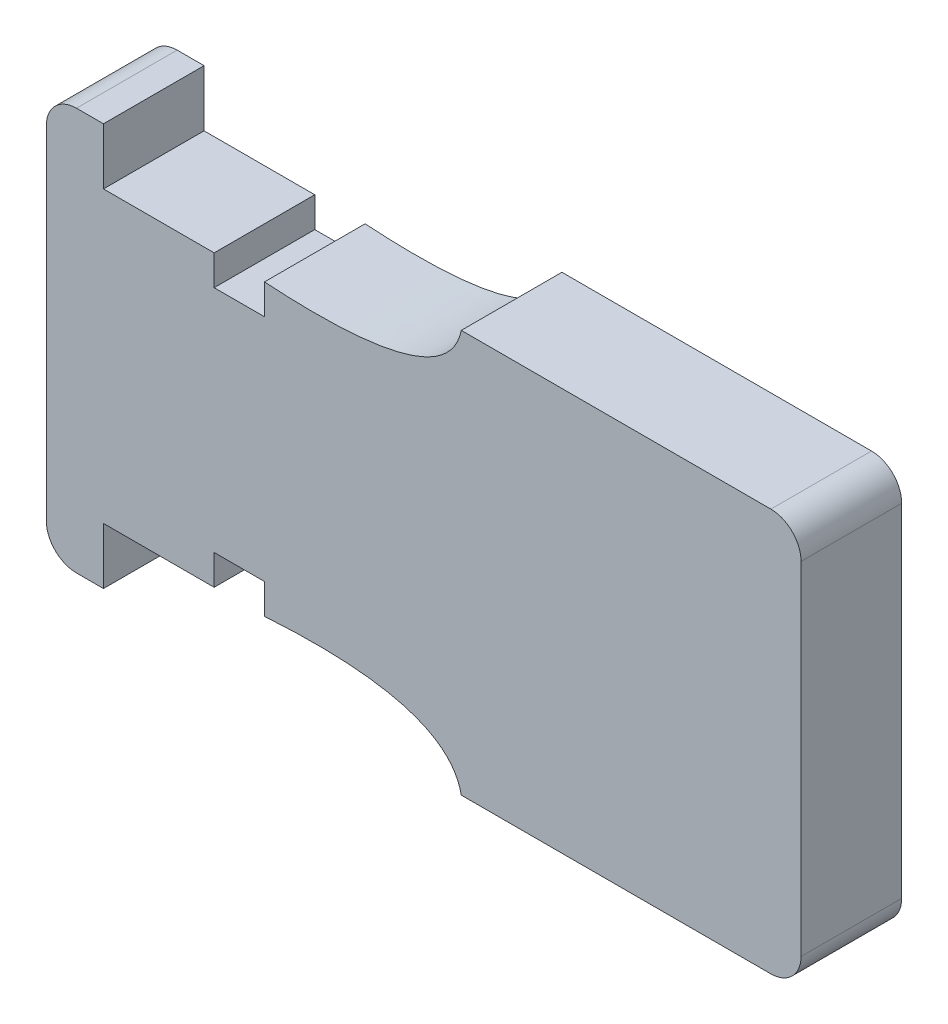
from build123d import *

# Parameters (mm, degrees)
EXTRUDE_THIN2_START                       = -25.4
EXTRUDE_THIN2_DEPTH                       = 25.4
BOSS_EXTRUDE1_START                       = -2.54
BOSS_EXTRUDE1_DEPTH                       = 2.54
BOSS_EXTRUDE2_DEPTH                       = 2.54
F_15_64_0_23438_DIAMETER_HOLE1_AT_2_COUNT = 2
F_15_64_0_23438_DIAMETER_HOLE1_AT_2_PITCH = 86.36
F_15_64_0_23438_DIAMETER_HOLE1_AT_3_COUNT = 2
F_15_64_0_23438_DIAMETER_HOLE1_AT_3_PITCH = 195.381977675
F_15_64_0_23438_DIAMETER_HOLE1_AT_4_COUNT = 2
F_15_64_0_23438_DIAMETER_HOLE1_AT_4_PITCH = 175.26


# Read off the part's stored shape, not the designer's step: Extrude-Thin2
with BuildPart() as part:
    # Extrude-Thin2 outline → Extrude-Thin2 (new body)
    with BuildSketch(Plane.XY.offset(EXTRUDE_THIN2_START)):
        with BuildLine():
            Line((-80.828024073, 36.556311377), (-80.828024073, 50.8))
            Line((-80.828024073, 50.8), (-87.63, 50.8))
            ThreePointArc((-87.63, 50.8), (-93.018153673, 48.568153673), (-95.25, 43.18))
            Line((-95.25, 43.18), (-95.25, -43.18))
            ThreePointArc((-95.25, -43.18), (-93.018153673, -48.568153673), (-87.63, -50.8))
            Line((-87.63, -50.8), (-80.828024073, -50.8))
            Line((-80.828024073, -50.8), (-80.828024073, -36.556311377))
            Line((-80.828024073, -36.556311377), (-52.888024073, -36.556311377))
            Line((-52.888024073, -36.556311377), (-52.888024073, -28.936311377))
            Line((-52.888024073, -28.936311377), (-40.188024073, -28.936311377))
            Line((-40.188024073, -28.936311377), (-40.188024073, -36.556311377))
            add(Edge.make_bspline(
                [(-40.188024073, -36.556311377), (6.000491779, -33.499243365), (9.490782471, -50.8)],
                knots=[0, 0, 0, 0.610951086, 0.610951086, 0.610951086], degree=2))
            Line((9.490782471, -50.8), (87.63, -50.8))
            ThreePointArc((87.63, -50.8), (93.018153673, -48.568153673), (95.25, -43.18))
            Line((95.25, -43.18), (95.25, 43.18))
            ThreePointArc((95.25, 43.18), (93.018153673, 48.568153673), (87.63, 50.8))
            Line((87.63, 50.8), (9.490782471, 50.8))
            add(Edge.make_bspline(
                [(9.490782471, 50.8), (6.000491779, 33.499243365), (-40.188024073, 36.556311377)],
                knots=[0, 0, 0, 0.610951086, 0.610951086, 0.610951086], degree=2))
            Line((-40.188024073, 36.556311377), (-40.188024073, 28.936311377))
            Line((-40.188024073, 28.936311377), (-52.888024073, 28.936311377))
            Line((-52.888024073, 28.936311377), (-52.888024073, 36.556311377))
            Line((-52.888024073, 36.556311377), (-80.828024073, 36.556311377))
        make_face()
        with BuildLine():
            Line((-87.63, 48.768), (-82.860024073, 48.768))
            Line((-82.860024073, 48.768), (-82.860024073, 34.524311377))
            Line((-82.860024073, 34.524311377), (-54.920024073, 34.524311377))
            Line((-54.920024073, 34.524311377), (-54.920024073, 26.904311377))
            Line((-54.920024073, 26.904311377), (-38.156024073, 26.904311377))
            Line((-38.156024073, 26.904311377), (-38.156024073, 34.395144422))
            add(Edge.make_bspline(
                [(11.059099877, 48.768), (10.705913599, 47.666821526), (10.231462505, 46.631478385), (9.34485534, 45.173434414), (9.020114118, 44.703275583), (8.31285443, 43.794325504), (7.932752955, 43.359154617), (6.738556789, 42.126829372), (5.863761314, 41.393125544), (4.455909096, 40.399393999), (3.970643089, 40.086351658), (2.987111557, 39.50137004), (2.48684241, 39.227961499), (0.964119528, 38.456915884), (-0.080085669, 38.008090834), (-1.679731191, 37.409665787), (-2.218549861, 37.222765467), (-3.306137501, 36.871294096), (-3.856031524, 36.7064305), (-6.610131831, 35.936843126), (-8.830751105, 35.489873067), (-13.293085078, 34.801180583), (-15.535017784, 34.561579267), (-20.033665755, 34.226203327), (-22.290452983, 34.13112888), (-26.815059954, 34.048320676), (-29.084850225, 34.060938072), (-33.62255889, 34.169687173), (-35.889894754, 34.26582406), (-38.156024073, 34.395144422)],
                knots=[0, 0, 0, 0, 0.0625, 0.0625, 0.09375, 0.09375, 0.125, 0.125, 0.1875, 0.1875, 0.21875, 0.21875, 0.25, 0.25, 0.3125, 0.3125, 0.34375, 0.34375, 0.375, 0.375, 0.5, 0.5, 0.625, 0.625, 0.75, 0.75, 0.875, 0.875, 1, 1, 1, 1], degree=3))
            Line((11.059099877, 48.768), (87.63, 48.768))
            ThreePointArc((87.63, 48.768), (91.581312693, 47.131312693), (93.218, 43.18))
            Line((93.218, 43.18), (93.218, -43.18))
            ThreePointArc((93.218, -43.18), (91.581312693, -47.131312693), (87.63, -48.768))
            Line((87.63, -48.768), (11.059099877, -48.768))
            add(Edge.make_bspline(
                [(-38.156024073, -34.395144422), (-35.889212951, -34.265785152), (-33.622237618, -34.169696181), (-29.087874945, -34.060993864), (-26.820488385, -34.048222574), (-23.419006743, -34.110473753), (-22.285112177, -34.144870035), (-20.017166217, -34.245437307), (-18.881979516, -34.311696432), (-15.488251882, -34.56581331), (-13.239736034, -34.807790371), (-8.782595463, -35.498966347), (-6.573640775, -35.946451198), (-3.306890482, -36.860175418), (-2.225854522, -37.205688462), (-0.62007844, -37.805919033), (-0.086320204, -38.02031336), (0.963955056, -38.476496538), (1.481482977, -38.71859586), (3.008182433, -39.492540914), (3.991806837, -40.071413071), (5.399027077, -41.06529203), (5.854721193, -41.41662922), (6.723566444, -42.153236805), (7.138582961, -42.539781101), (8.320387349, -43.758860403), (9.024746312, -44.65099332), (10.229082778, -46.623668325), (10.706098691, -47.667398611), (11.059099877, -48.768)],
                knots=[0, 0, 0, 0, 0.125, 0.125, 0.25, 0.25, 0.3125, 0.3125, 0.375, 0.375, 0.5, 0.5, 0.625, 0.625, 0.6875, 0.6875, 0.71875, 0.71875, 0.75, 0.75, 0.8125, 0.8125, 0.84375, 0.84375, 0.875, 0.875, 0.9375, 0.9375, 1, 1, 1, 1], degree=3))
            Line((-38.156024073, -34.395144422), (-38.156024073, -26.904311377))
            Line((-38.156024073, -26.904311377), (-54.920024073, -26.904311377))
            Line((-54.920024073, -26.904311377), (-54.920024073, -34.524311377))
            Line((-54.920024073, -34.524311377), (-82.860024073, -34.524311377))
            Line((-82.860024073, -34.524311377), (-82.860024073, -48.768))
            Line((-82.860024073, -48.768), (-87.63, -48.768))
            ThreePointArc((-87.63, -48.768), (-91.581312693, -47.131312693), (-93.218, -43.18))
            Line((-93.218, -43.18), (-93.218, 43.18))
            ThreePointArc((-93.218, 43.18), (-91.581312693, 47.131312693), (-87.63, 48.768))
        make_face(mode=Mode.SUBTRACT)
    extrude(amount=EXTRUDE_THIN2_DEPTH)

    # Sketch11<2> → Boss-Extrude1 (add)
    with BuildSketch(Plane.XY.offset(BOSS_EXTRUDE1_START)):
        with BuildLine():
            Line((-80.828024073, 50.8), (-80.828024073, 36.556311377))
            Line((-80.828024073, 36.556311377), (-52.888024073, 36.556311377))
            Line((-52.888024073, 36.556311377), (-52.888024073, 28.936311377))
            Line((-52.888024073, 28.936311377), (-40.188024073, 28.936311377))
            Line((-40.188024073, 28.936311377), (-40.188024073, 36.556311377))
            add(Edge.make_bspline(
                [(-40.188024073, 36.556311377), (6.000491779, 33.499243365), (9.490782471, 50.8)],
                knots=[0, 0, 0, 0.610951086, 0.610951086, 0.610951086], degree=2))
            Line((9.490782471, 50.8), (87.63, 50.8))
            ThreePointArc((87.63, 50.8), (93.018153673, 48.568153673), (95.25, 43.18))
            Line((95.25, 43.18), (95.25, -43.18))
            ThreePointArc((95.25, -43.18), (93.018153673, -48.568153673), (87.63, -50.8))
            Line((87.63, -50.8), (9.490782471, -50.8))
            add(Edge.make_bspline(
                [(-40.188024073, -36.556311377), (6.000491779, -33.499243365), (9.490782471, -50.8)],
                knots=[0, 0, 0, 0.610951086, 0.610951086, 0.610951086], degree=2))
            Line((-40.188024073, -36.556311377), (-40.188024073, -28.936311377))
            Line((-40.188024073, -28.936311377), (-52.888024073, -28.936311377))
            Line((-52.888024073, -28.936311377), (-52.888024073, -36.556311377))
            Line((-52.888024073, -36.556311377), (-80.828024073, -36.556311377))
            Line((-80.828024073, -36.556311377), (-80.828024073, -50.8))
            Line((-80.828024073, -50.8), (-87.63, -50.8))
            ThreePointArc((-87.63, -50.8), (-93.018153673, -48.568153673), (-95.25, -43.18))
            Line((-95.25, -43.18), (-95.25, 43.18))
            ThreePointArc((-95.25, 43.18), (-93.018153673, 48.568153673), (-87.63, 50.8))
            Line((-87.63, 50.8), (-80.828024073, 50.8))
        make_face()
    extrude(amount=BOSS_EXTRUDE1_DEPTH)

    # Sketch14 → Boss-Extrude2 (add)
    with BuildSketch(Plane(origin=(0, 0, -25.4), x_dir=(-1, 0, 0), z_dir=(0, 0, -1))):
        with BuildLine():
            ThreePointArc((-95.25, -43.18), (-93.018153673, -48.568153673), (-87.63, -50.8))
            Line((-87.63, -50.8), (-81.532541243, -50.8))
            Line((-81.532541243, -50.8), (-81.532541243, -36.556311377))
            Line((-81.532541243, -36.556311377), (-95.25, -36.556311377))
            Line((-95.25, -36.556311377), (-95.25, -43.18))
        make_face()
        with BuildLine():
            Line((-95.25, 43.18), (-95.25, 36.556311377))
            Line((-95.25, 36.556311377), (-81.532541243, 36.556311377))
            Line((-81.532541243, 36.556311377), (-81.532541243, 50.8))
            Line((-81.532541243, 50.8), (-87.63, 50.8))
            ThreePointArc((-87.63, 50.8), (-93.018153673, 48.568153673), (-95.25, 43.18))
        make_face()
        with BuildLine():
            Line((95.25, -43.18), (95.25, -36.556311377))
            Line((95.25, -36.556311377), (80.828024073, -36.556311377))
            Line((80.828024073, -36.556311377), (80.828024073, -50.8))
            Line((80.828024073, -50.8), (87.63, -50.8))
            ThreePointArc((87.63, -50.8), (93.018153673, -48.568153673), (95.25, -43.18))
        make_face()
        with BuildLine():
            Line((87.63, 50.8), (80.828024073, 50.8))
            Line((80.828024073, 50.8), (80.828024073, 36.556311377))
            Line((80.828024073, 36.556311377), (95.25, 36.556311377))
            Line((95.25, 36.556311377), (95.25, 43.18))
            ThreePointArc((95.25, 43.18), (93.018153673, 48.568153673), (87.63, 50.8))
        make_face()
    extrude(amount=-BOSS_EXTRUDE2_DEPTH)

    # Sketch15 → 15/64 (0.23438) Diameter Hole1 (revolve, cut)
    with BuildSketch(Plane(origin=(87.63, 43.18, -25.4), x_dir=(0, 1, 0), z_dir=(1, 0, 0))):
        Polygon((0, 0), (0, 2.54), (2.976626, 2.54), (2.976626, 0.532828266), (3.611626, 0), align=None)
    f_15_64_0_23438_diameter_hole1 = revolve(axis=Axis((87.63, 43.18, -31.75), (0, 0, 1)), mode=Mode.SUBTRACT)

    # 15/64 (0.23438) Diameter Hole1 at 2: 15/64 (0.23438) Diameter Hole1 ×2
    with Locations(*[(0, -i * F_15_64_0_23438_DIAMETER_HOLE1_AT_2_PITCH, 0) for i in range(1, F_15_64_0_23438_DIAMETER_HOLE1_AT_2_COUNT)]):
        add(f_15_64_0_23438_diameter_hole1, mode=Mode.SUBTRACT)

    # 15/64 (0.23438) Diameter Hole1 at 3: 15/64 (0.23438) Diameter Hole1 ×2
    with Locations(*[Vector(-0.8970121097452229, -0.44200596712083456, 0) * (i * F_15_64_0_23438_DIAMETER_HOLE1_AT_3_PITCH) for i in range(1, F_15_64_0_23438_DIAMETER_HOLE1_AT_3_COUNT)]):
        add(f_15_64_0_23438_diameter_hole1, mode=Mode.SUBTRACT)

    # 15/64 (0.23438) Diameter Hole1 at 4: 15/64 (0.23438) Diameter Hole1 ×2
    with Locations(*[(-i * F_15_64_0_23438_DIAMETER_HOLE1_AT_4_PITCH, 0, 0) for i in range(1, F_15_64_0_23438_DIAMETER_HOLE1_AT_4_COUNT)]):
        add(f_15_64_0_23438_diameter_hole1, mode=Mode.SUBTRACT)


solid = part.part
